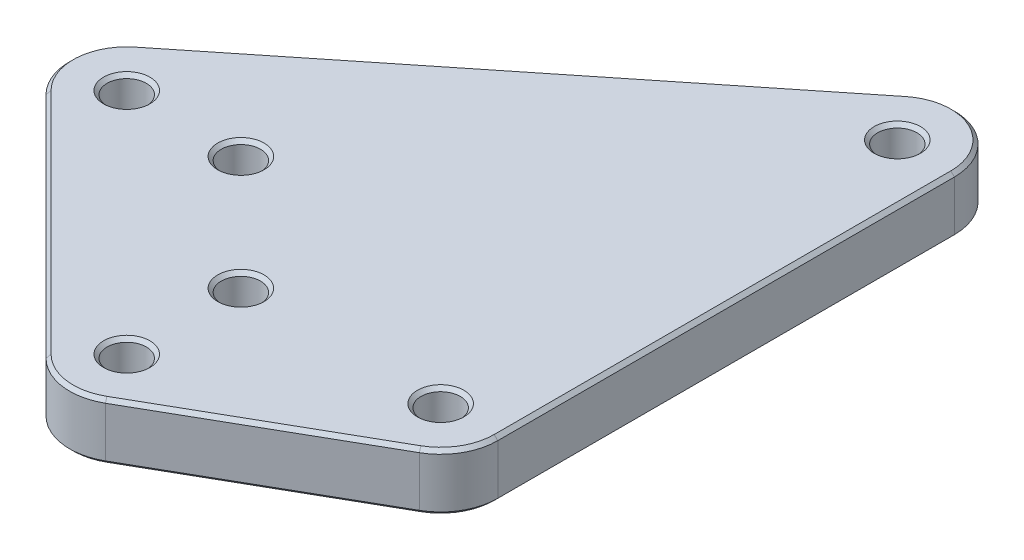
from build123d import *

# Parameters (mm, degrees)
SKETCH1_R           = 2.1828125
BOSS_EXTRUDE1_DEPTH = 6.35
CHAMFER1_SIZE       = 0.396875


with BuildPart() as part:
    # Sketch1 → Boss-Extrude1 (new body)
    with BuildSketch(Plane(origin=(0, 0, 0), x_dir=(1, 0, 0), z_dir=(0, 1, 0))):
        with BuildLine():
            Line((-51.591813552, 17.65851694), (-3.966813552, 55.75851694))
            ThreePointArc((-3.966813552, 55.75851694), (2.750748439, 56.523275551), (6.35, 50.8))
            Line((6.35, 50.8), (6.35, 0))
            ThreePointArc((6.35, 0), (5.492179091, -3.187235296), (3.150482259, -5.513343952))
            Line((3.150482259, -5.513343952), (-19.074517741, -18.213343952))
            ThreePointArc((-19.074517741, -18.213343952), (-23.067855509, -18.993813994), (-26.715128061, -17.190128061))
            Line((-26.715128061, -17.190128061), (-52.115128061, 8.209871939))
            ThreePointArc((-52.115128061, 8.209871939), (-53.965282994, 13.051157449), (-51.591813552, 17.65851694))
        make_face()
        Circle(SKETCH1_R, mode=Mode.SUBTRACT)
        with Locations((0, 50.8)):
            Circle(SKETCH1_R, mode=Mode.SUBTRACT)
        with Locations((-22.225, 0)):
            Circle(SKETCH1_R, mode=Mode.SUBTRACT)
        with Locations((-22.225, -12.7)):
            Circle(SKETCH1_R, mode=Mode.SUBTRACT)
        with Locations((-34.925, 12.7)):
            Circle(SKETCH1_R, mode=Mode.SUBTRACT)
        with Locations((-47.625, 12.7)):
            Circle(SKETCH1_R, mode=Mode.SUBTRACT)
    extrude(amount=BOSS_EXTRUDE1_DEPTH)

    # Chamfer1
    chamfer1_edges = [part.edges().sort_by_distance(p)[0] for p in [
        (-49.8078125, 0, -12.7),
        (-37.1078125, 0, -12.7),
        (-24.4078125, 0, 12.7),
        (-24.4078125, 0, 0),
        (-2.1828125, 0, -50.8),
        (-2.1828125, 0, 0),
        (-39.415128061, 0, 4.490128061),
        (-23.067855509, 0, 18.993813994),
        (-7.962017741, 0, 11.863343952),
        (5.492179091, 0, 3.187235296),
        (6.35, 0, -25.4),
        (2.750748439, 0, -56.523275551),
        (-27.779313552, 0, -36.70851694),
        (-53.965282994, 0, -13.051157449),
        (-49.8078125, 6.35, -12.7),
        (-24.4078125, 6.35, 12.7),
        (-2.1828125, 6.35, -50.8),
        (-27.779313552, 6.35, -36.70851694),
        (2.750748439, 6.35, -56.523275551),
        (6.35, 6.35, -25.4),
        (5.492179091, 6.35, 3.187235296),
        (-7.962017741, 6.35, 11.863343952),
        (-23.067855509, 6.35, 18.993813994),
        (-39.415128061, 6.35, 4.490128061),
        (-53.965282994, 6.35, -13.051157449),
        (-2.1828125, 6.35, 0),
        (-24.4078125, 6.35, 0),
        (-37.1078125, 6.35, -12.7),
    ]]
    chamfer(chamfer1_edges, length=CHAMFER1_SIZE)


solid = part.part
